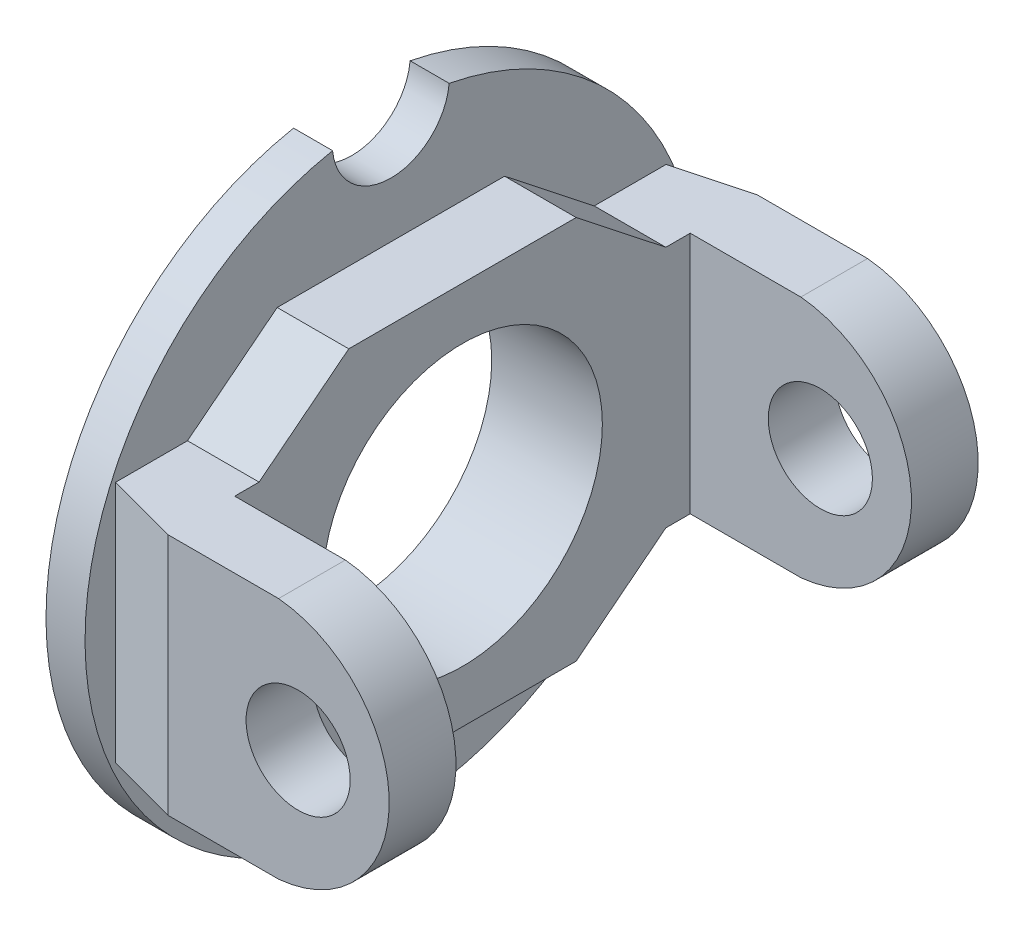
from build123d import *

# Parameters (mm, degrees)
SKETCH1_R           = 10.75
BOSS_EXTRUDE1_DEPTH = 3
SKETCH2_R           = 10.75
BOSS_EXTRUDE2_DEPTH = 5.5
DRAFT5_START        = -9.337185289
DRAFT5_DEPTH        = 18.674370578
SKETCH3_W           = 5.126913696
SKETCH3_H           = 18.674370578
BOSS_EXTRUDE3_DEPTH = 17
CUT_EXTRUDE1_REACH  = 59.708
CUT_EXTRUDE2_REACH  = 59.708
SKETCH5_R           = 4


# Read off the part's stored shape, not the designer's step: Draft5
with BuildPart() as part:
    # Sketch1 → Boss-Extrude1 (new body)
    with BuildSketch(Plane(origin=(0, 0, 0), x_dir=(0, 0, -1), z_dir=(1, 0, 0))):
        with BuildLine():
            ThreePointArc((-4.479326664, 23.069148936), (0, -23.5), (4.479326664, 23.069148936))
            ThreePointArc((4.479326664, 23.069148936), (0, 19), (-4.479326664, 23.069148936))
        make_face()
        Circle(SKETCH1_R, mode=Mode.SUBTRACT)
    extrude(amount=BOSS_EXTRUDE1_DEPTH)

    # Sketch2 → Boss-Extrude2 (add)
    # profile 1 of 7: a face of its own
    with BuildSketch(Plane(origin=(3, 0, 0), x_dir=(0, 0, -1), z_dir=(1, 0, 0))):
        with BuildLine():
            Line((-15.626913696, -9.337185289), (-15.626913696, 9.337185289))
            Line((-15.626913696, 9.337185289), (-21.565411447, 9.337185289))
            ThreePointArc((-21.565411447, 9.337185289), (-22.146716975, 7.859575512), (-22.626913696, 6.346083564))
            Line((-22.626913696, 6.346083564), (-22.626913696, -6.346083564))
            ThreePointArc((-22.626913696, -6.346083564), (-22.146716975, -7.859575512), (-21.565411447, -9.337185289))
            Line((-21.565411447, -9.337185289), (-15.626913696, -9.337185289))
        make_face()
    # profile 2 of 7: a face of its own
    with BuildSketch(Plane(origin=(3, 0, 0), x_dir=(0, 0, -1), z_dir=(1, 0, 0))):
        Polygon((-15.626913696, -9.337185289), (-15.626913696, 9.337185289), (-8.736803998, 14.760144229), (8.736803998, 14.760144229), (15.626913696, 9.337185289), (15.626913696, -9.337185289), (8.736803998, -14.760144229), (-8.736803998, -14.760144229), align=None)
        Circle(SKETCH2_R, mode=Mode.SUBTRACT)
    # profile 3 of 7: a face of its own
    with BuildSketch(Plane(origin=(3, 0, 0), x_dir=(0, 0, -1), z_dir=(1, 0, 0))):
        with BuildLine():
            Line((21.565411447, 9.337185289), (15.626913696, 9.337185289))
            Line((15.626913696, 9.337185289), (15.626913696, -9.337185289))
            Line((15.626913696, -9.337185289), (21.565411447, -9.337185289))
            ThreePointArc((21.565411447, -9.337185289), (22.146716975, -7.859575512), (22.626913696, -6.346083564))
            Line((22.626913696, -6.346083564), (22.626913696, 6.346083564))
            ThreePointArc((22.626913696, 6.346083564), (22.146716975, 7.859575512), (21.565411447, 9.337185289))
        make_face()
    # profile 4 of 7: a face of its own
    with BuildSketch(Plane(origin=(3, 0, 0), x_dir=(0, 0, -1), z_dir=(1, 0, 0))):
        with BuildLine():
            ThreePointArc((-22.626913696, 6.346083564), (-22.146716975, 7.859575512), (-21.565411447, 9.337185289))
            Line((-21.565411447, 9.337185289), (-22.626913696, 9.337185289))
            Line((-22.626913696, 9.337185289), (-22.626913696, 6.346083564))
        make_face()
    # profile 5 of 7: a face of its own
    with BuildSketch(Plane(origin=(3, 0, 0), x_dir=(0, 0, -1), z_dir=(1, 0, 0))):
        with BuildLine():
            Line((-22.626913696, -9.337185289), (-21.565411447, -9.337185289))
            ThreePointArc((-21.565411447, -9.337185289), (-22.146716975, -7.859575512), (-22.626913696, -6.346083564))
            Line((-22.626913696, -6.346083564), (-22.626913696, -9.337185289))
        make_face()
    # profile 6 of 7: a face of its own
    with BuildSketch(Plane(origin=(3, 0, 0), x_dir=(0, 0, -1), z_dir=(1, 0, 0))):
        with BuildLine():
            Line((22.626913696, 9.337185289), (21.565411447, 9.337185289))
            ThreePointArc((21.565411447, 9.337185289), (22.146716975, 7.859575512), (22.626913696, 6.346083564))
            Line((22.626913696, 6.346083564), (22.626913696, 9.337185289))
        make_face()
    # profile 7 of 7: a face of its own
    with BuildSketch(Plane(origin=(3, 0, 0), x_dir=(0, 0, -1), z_dir=(1, 0, 0))):
        with BuildLine():
            ThreePointArc((22.626913696, -6.346083564), (22.146716975, -7.859575512), (21.565411447, -9.337185289))
            Line((21.565411447, -9.337185289), (22.626913696, -9.337185289))
            Line((22.626913696, -9.337185289), (22.626913696, -6.346083564))
        make_face()
    extrude(amount=BOSS_EXTRUDE2_DEPTH)

    # Draft5 outline → Draft5 (cut)
    with BuildSketch(Plane(origin=(0, 0, 0), x_dir=(1, 0, 0), z_dir=(0, 1, 0)).offset(DRAFT5_START)):
        Polygon((3, 22.626913696), (3, 21.153193137), (8.5, 22.626913696), align=None)
        Polygon((3, -21.153193137), (3, -22.626913696), (8.5, -22.626913696), align=None)
    extrude(amount=DRAFT5_DEPTH, mode=Mode.SUBTRACT)

    # Sketch3 → Boss-Extrude3 (add)
    with BuildSketch(Plane(origin=(8.5, 0, 0), x_dir=(0, 0, -1), z_dir=(1, 0, 0))):
        with Locations((-20.063456848, 0)):
            Rectangle(SKETCH3_W, SKETCH3_H)
        with Locations((20.063456848, 0)):
            Rectangle(SKETCH3_W, SKETCH3_H)
    extrude(amount=BOSS_EXTRUDE3_DEPTH)

    # Cut-Extrude1: up to this face of the body (flat: up to its plane)
    cut_extrude1_end = Plane(part.part.faces().sort_by_distance((17, 0, -22.626913696))[0])
    # Sketch4 → Cut-Extrude1 (cut, up to the picked face)
    with BuildSketch(Plane.XY.offset(22.626913696), mode=Mode.PRIVATE) as cut_extrude1_sk1:
        with BuildLine():
            Line((17, 9.337185289), (17, 12.880835783))
            Line((17, 12.880835783), (29.443712865, 12.880835783))
            Line((29.443712865, 12.880835783), (29.443712865, -13.088571654))
            Line((29.443712865, -13.088571654), (17, -13.088571654))
            Line((17, -13.088571654), (17, -9.337185289))
            ThreePointArc((17, -9.337185289), (25.5, 0), (17, 9.337185289))
        make_face()
    cut_extrude1_tool1 = split(extrude(cut_extrude1_sk1.sketch, amount=-CUT_EXTRUDE1_REACH, mode=Mode.PRIVATE), bisect_by=cut_extrude1_end, keep=Keep.BOTH, mode=Mode.PRIVATE)
    add(cut_extrude1_tool1.solids().sort_by(Axis((17.287968, 11.109011, 22.626914), (0, 0, -1)))[0], mode=Mode.SUBTRACT)

    # Cut-Extrude2: up to this face of the body (flat: up to its plane)
    cut_extrude2_end = Plane(part.part.faces().sort_by_distance((16.148390538, 0, -22.626913696))[0])
    # Sketch5 → Cut-Extrude2 (cut, up to the picked face)
    with BuildSketch(Plane.XY.offset(22.626913696), mode=Mode.PRIVATE) as cut_extrude2_sk1:
        with Locations(Location((18.5, 0, 0), (0, 0, 270))):
            Circle(SKETCH5_R)
    cut_extrude2_tool1 = split(extrude(cut_extrude2_sk1.sketch, amount=-CUT_EXTRUDE2_REACH, mode=Mode.PRIVATE), bisect_by=cut_extrude2_end, keep=Keep.BOTH, mode=Mode.PRIVATE)
    add(cut_extrude2_tool1.solids().sort_by(Axis((18.5, 0, 22.626914), (0, 0, -1)))[0], mode=Mode.SUBTRACT)


solid = part.part
